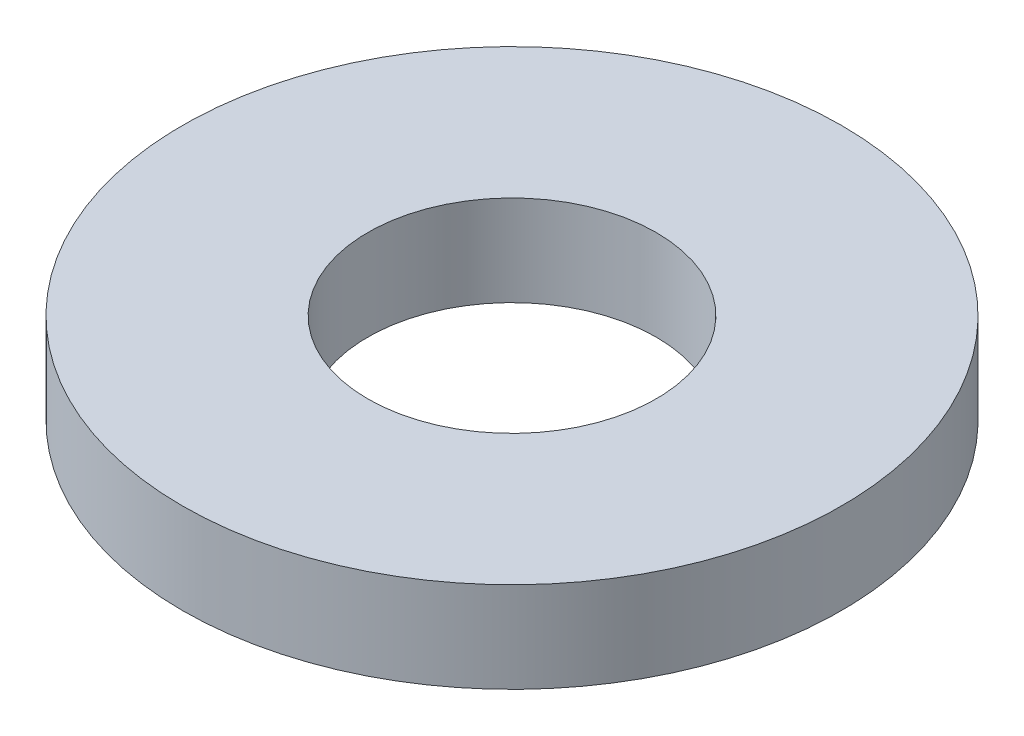
from build123d import *

# Parameters (mm, degrees)
SKETCH1_R           = 80
BOSS_EXTRUDE1_DEPTH = 22
SKETCH2_R           = 35
CUT_EXTRUDE1_DEPTH  = 116.256236274


with BuildPart() as part:
    # Sketch1 → Boss-Extrude1 (new body)
    with BuildSketch(Plane(origin=(0, 0, 0), x_dir=(1, 0, 0), z_dir=(0, 1, 0))):
        Circle(SKETCH1_R)
    extrude(amount=BOSS_EXTRUDE1_DEPTH)

    # Sketch2 → Cut-Extrude1 (cut, through all)
    with BuildSketch(Plane(origin=(0, 0, 0), x_dir=(1, 0, 0), z_dir=(0, 1, 0))):
        Circle(SKETCH2_R)
    extrude(amount=CUT_EXTRUDE1_DEPTH, mode=Mode.SUBTRACT)


solid = part.part
